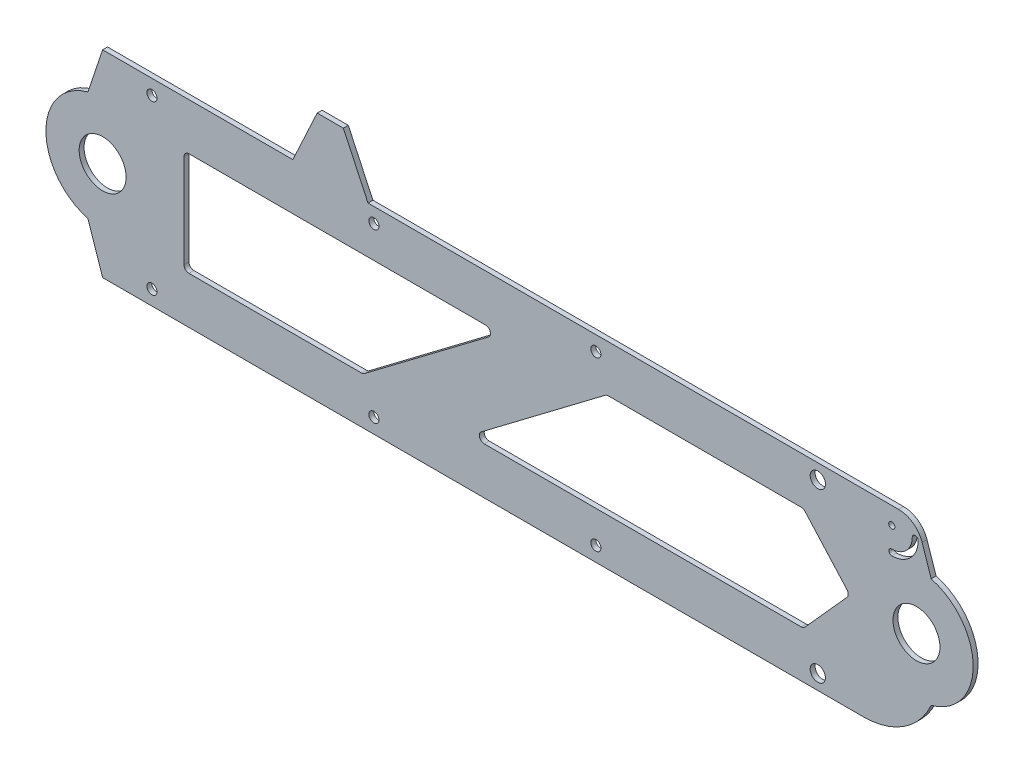
from build123d import *

# Parameters (mm, degrees)
SKETCH_1_R          = 9.52
SKETCH_1_R_2        = 1.25
EXTRUDE_1_DEPTH     = 2
SKETCH_2_R          = 2.05
SKETCH_2_R_2        = 3.1
CUT_EXTRUDE_1_DEPTH = 4
FILLET_1_R          = 2
FILLET_3_R          = 30
FILLET_6_R          = 10


with BuildPart() as part:
    # 草图1 → 凸台-拉伸1 (new body)
    with BuildSketch(Plane.XY):
        with BuildLine():
            Line((328.542857143, -40.145714286), (-1.457142857, -40.145714286))
            Line((-1.457142857, -40.145714286), (-7.409980895, -22.36200829))
            ThreePointArc((-7.409980895, -22.36200829), (-24.457142857, -0.145714286), (-7.409980895, 22.070579719))
            Line((-7.409980895, 22.070579719), (-1.457142857, 39.854285714))
            Line((-1.457142857, 39.854285714), (75.684411109, 39.854285714))
            Line((75.684411109, 39.854285714), (85.544413109, 61.154285714))
            Line((85.544413109, 61.154285714), (96.174870529, 61.154285714))
            Line((96.174870529, 61.154285714), (106.145912956, 39.854285714))
            Line((106.145912956, 39.854285714), (321.071621128, 39.854285714))
            Line((321.071621128, 39.854285714), (328.542857143, 39.854285714))
            Line((328.542857143, 39.854285714), (334.49569518, 22.070579719))
            ThreePointArc((334.49569518, 22.070579719), (351.542857143, -0.145714286), (334.49569518, -22.36200829))
            Line((334.49569518, -22.36200829), (328.542857143, -40.145714286))
        make_face()
        with Locations((-1.457142857, -0.145714286)):
            Circle(SKETCH_1_R, mode=Mode.SUBTRACT)
        with Locations((328.542857143, -0.145714286)):
            Circle(SKETCH_1_R, mode=Mode.SUBTRACT)
        with Locations((318.542857143, 32.854285714)):
            Circle(SKETCH_1_R_2, mode=Mode.SUBTRACT)
        with BuildLine():
            ThreePointArc((318.542857143, 22.154285714), (326.108899702, 25.288243156), (329.242857143, 32.854285714))
            ThreePointArc((329.242857143, 32.854285714), (328.042857143, 34.054285714), (326.842857143, 32.854285714))
            ThreePointArc((326.842857143, 32.854285714), (324.411843427, 26.98529943), (318.542857143, 24.554285714))
            ThreePointArc((318.542857143, 24.554285714), (317.342857143, 23.354285714), (318.542857143, 22.154285714))
        make_face(mode=Mode.SUBTRACT)
    extrude(amount=EXTRUDE_1_DEPTH)

    # 草图2 → 切除-拉伸1 (cut)
    with BuildSketch(Plane.XY.offset(2)):
        with Locations((108.542857143, 33.854285714)):
            Circle(SKETCH_2_R)
        with Locations((198.542857143, 33.854285714)):
            Circle(SKETCH_2_R)
        with Locations((108.542857143, -34.145714286)):
            Circle(SKETCH_2_R)
        with Locations((198.542857143, -34.145714286)):
            Circle(SKETCH_2_R)
        with Locations((18.542857143, -34.145714286)):
            Circle(SKETCH_2_R)
        with Locations((18.542857143, 33.854285714)):
            Circle(SKETCH_2_R)
        with Locations((288.542857143, 33.854285714)):
            Circle(SKETCH_2_R_2)
        with Locations((288.542857143, -34.145714286)):
            Circle(SKETCH_2_R_2)
        Polygon((31.542857143, -21.145714286), (104.183898028, -21.145714286), (159.772133322, 20.854285714), (31.542857143, 20.854285714), align=None)
        Polygon((147.313580964, -21.145714286), (202.901816258, 20.854285714), (282.737923896, 20.854285714), (301.563806249, -0.145714286), (282.737923896, -21.145714286), align=None)
    extrude(amount=-CUT_EXTRUDE_1_DEPTH, mode=Mode.SUBTRACT)

    # 圆角1
    fillet_1_edges = [part.edges().sort_by_distance(p)[0] for p in [
        (282.737923896, -21.145714286, 1),
        (147.313580964, -21.145714286, 1),
        (202.901816258, 20.854285714, 1),
        (282.737923896, 20.854285714, 1),
        (301.563806249, -0.145714286, 1),
        (31.542857143, -21.145714286, 1),
        (31.542857143, 20.854285714, 1),
        (159.772133322, 20.854285714, 1),
        (104.183898028, -21.145714286, 1),
    ]]
    fillet(fillet_1_edges, radius=FILLET_1_R)

    # 圆角3
    # the kernel refuses this fillet: 30 mm, written as the material it takes off along each edge
    with BuildSketch(Plane(origin=(328.542857143, -40.145714286, -53.618003483), x_dir=(0.3174242162824087, 0.9482836426499714, 0), z_dir=(0, 0, 1))) as fillet_3_piece_1:
        with BuildLine():
            CenterArc((21.640648186, 29.86075675), FILLET_3_R, 198.507223716, 65.970321092)
            Line((-6.807861094, 20.338030262), (-7.376831279, 20.147575732))
            Line((-7.376831279, 20.147575732), (-0.568970186, -0.19045453))
            Line((-0.568970186, -0.19045453), (0, -0.6))
            ThreePointArc((0, -0.6), (9.376786225, -0.6), (18.695830935, -0.597215135))
            Line((18.695830935, -0.597215135), (18.75357245, 0))
        make_face()
    extrude(amount=109.236006966, mode=Mode.SUBTRACT)

    # 圆角6
    fillet_6_edges = [part.edges().sort_by_distance(p)[0] for p in [
        (328.542857143, 39.854285714, 1),
    ]]
    fillet(fillet_6_edges, radius=FILLET_6_R)


solid = part.part
